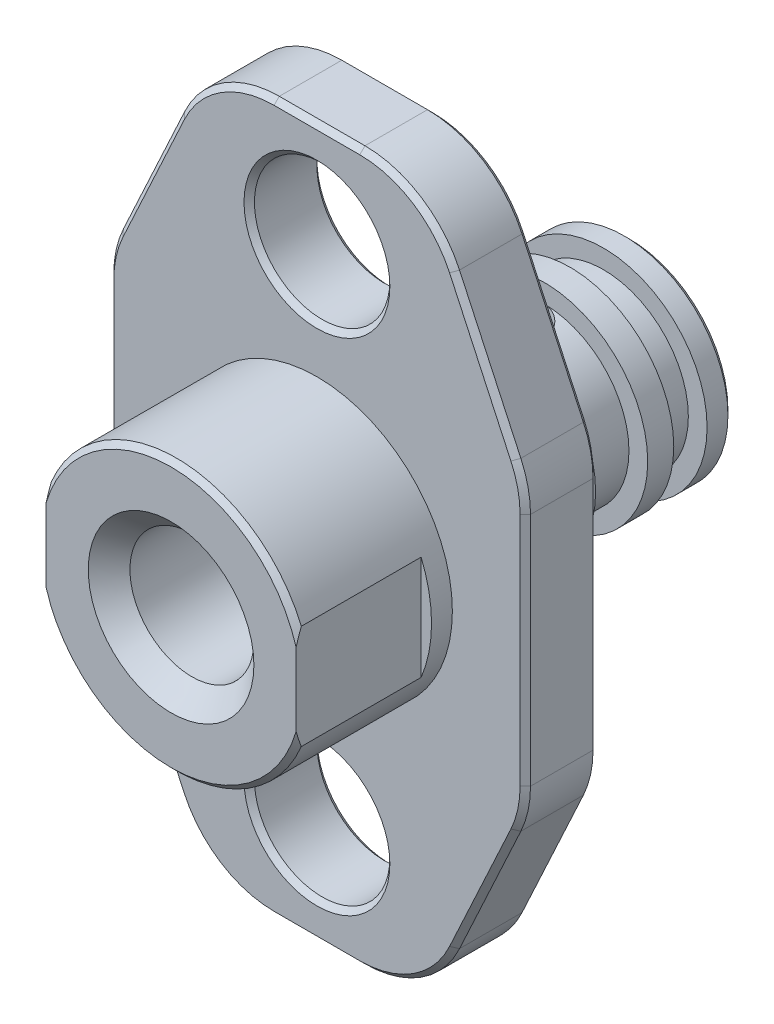
from build123d import *

# Parameters (mm, degrees)
SKETCH3_OUTSIDE_W  = 93.666
SKETCH3_OUTSIDE_H  = 93.666
SKETCH3_OUTSIDE_R  = 6.5
CUT_EXTRUDE1_DEPTH = 21
SKETCH4_W          = 2.5
SKETCH4_H          = 24.819260196
SKETCH7_W          = 2.358889098
SKETCH7_H          = 15
CUT_EXTRUDE2_DEPTH = 12
CIRPATTERN1_COUNT  = 2
CIRPATTERN1_ANGLE  = 180
CHAMFER1_SIZE      = 0.5


with BuildPart() as part:
    # Sketch1 → Revolve1 (revolve)
    with BuildSketch(Plane(origin=(0, 0, 0), x_dir=(0, 0, -1), z_dir=(1, 0, 0))):
        Polygon((14, 13), (0.5, 13), (0, 12.5), (0, 7.95), (2, 5.95), (19, 5.95), (20.171678207, 4), (38, 4), (40.403442476, 0), (44, 0), (44, 9.45), (43.5, 9.95), (41.5, 9.95), (41.5, 8.15), (38.3, 8.15), (38.3, 9.95), (35.8, 9.95), (35.8, 8.15), (30.8, 8.15), (30.8, 9.95), (28.3, 9.95), (28.3, 8.15), (25.1, 8.15), (25.1, 9.95), (21, 9.95), (21, 35), (14, 35), align=None)
    revolve(axis=Axis((0, 0, 0), (0, 0, -1)))

    # Sketch3 outside → Cut-Extrude1 (cut)
    # profile 1 of 3: a face of its own
    with BuildSketch(Plane.XY):
        Rectangle(SKETCH3_OUTSIDE_W, SKETCH3_OUTSIDE_H)
        with BuildLine():
            Line((-20, 11.295529415), (-20, -11.295529415))
            ThreePointArc((-20, -11.295529415), (-19.765527652, -13.448311261), (-19.073106065, -15.500139543))
            Line((-19.073106065, -15.500139543), (-13.185668477, -28.204610128))
            ThreePointArc((-13.185668477, -28.204610128), (-9.495586596, -32.427517466), (-4.112562412, -34))
            Line((-4.112562412, -34), (4.112562412, -34))
            ThreePointArc((4.112562412, -34), (9.495586596, -32.427517466), (13.185668477, -28.204610128))
            Line((13.185668477, -28.204610128), (19.073106065, -15.500139543))
            ThreePointArc((19.073106065, -15.500139543), (19.765527652, -13.448311261), (20, -11.295529415))
            Line((20, -11.295529415), (20, 11.295529415))
            ThreePointArc((20, 11.295529415), (19.765527652, 13.448311261), (19.073106065, 15.500139543))
            Line((19.073106065, 15.500139543), (13.185668477, 28.204610128))
            ThreePointArc((13.185668477, 28.204610128), (9.495586596, 32.427517466), (4.112562412, 34))
            Line((4.112562412, 34), (-4.112562412, 34))
            ThreePointArc((-4.112562412, 34), (-9.495586596, 32.427517466), (-13.185668477, 28.204610128))
            Line((-13.185668477, 28.204610128), (-19.073106065, 15.500139543))
            ThreePointArc((-19.073106065, 15.500139543), (-19.765527652, 13.448311261), (-20, 11.295529415))
        make_face(mode=Mode.SUBTRACT)
    # profile 2 of 3: a face of its own
    with BuildSketch(Plane.XY):
        with Locations((0, 24)):
            Circle(SKETCH3_OUTSIDE_R)
    # profile 3 of 3: a face of its own
    with BuildSketch(Plane.XY):
        with Locations((0, -24)):
            Circle(SKETCH3_OUTSIDE_R)
    extrude(amount=-CUT_EXTRUDE1_DEPTH, mode=Mode.SUBTRACT)

    # Sketch4 → Cut-Revolve1 (revolve, cut)
    with BuildSketch(Plane(origin=(0, 0, 0), x_dir=(0, 0, -1), z_dir=(1, 0, 0))):
        with Locations((34.55, 0)):
            Rectangle(SKETCH4_W, SKETCH4_H)
    revolve(axis=Axis((0, 12.409630098, -33.3), (0, -1, 0)), mode=Mode.SUBTRACT)

    # Sketch7 → Cut-Extrude2 (cut)
    with BuildSketch(Plane.XY):
        with Locations((-13.179444549, -0.815585695)):
            Rectangle(SKETCH7_W, SKETCH7_H)
    cut_extrude2 = extrude(amount=-CUT_EXTRUDE2_DEPTH, mode=Mode.SUBTRACT)

    # CirPattern1: Cut-Extrude2 ×2 about axis
    cirpattern1_axis = Axis((0, 0, 0), (0, 0, -1))
    for i in range(1, CIRPATTERN1_COUNT):
        add(cut_extrude2.rotate(cirpattern1_axis, i * CIRPATTERN1_ANGLE / (CIRPATTERN1_COUNT - 1)), mode=Mode.SUBTRACT)

    # Chamfer1
    chamfer1_edges = [part.edges().sort_by_distance(p)[0] for p in [
        (-6.5, 24, -14),
        (-6.5, 24, -21),
        (-6.5, -24, -14),
        (-6.5, -24, -21),
        (-9.495586596, 32.427517466, -14),
        (0, 34, -14),
        (-16.129387271, 21.852374836, -14),
        (9.495586596, 32.427517466, -14),
        (-19.765527652, 13.448311261, -14),
        (16.129387271, 21.852374836, -14),
        (-20, 0, -14),
        (19.765527652, 13.448311261, -14),
        (-19.765527652, -13.448311261, -14),
        (20, 0, -14),
        (-16.129387271, -21.852374836, -14),
        (19.765527652, -13.448311261, -14),
        (-9.495586596, -32.427517466, -14),
        (16.129387271, -21.852374836, -14),
        (0, -34, -14),
        (9.495586596, -32.427517466, -14),
        (-16.129387271, 21.852374836, -21),
        (-19.765527652, 13.448311261, -21),
        (-9.495586596, 32.427517466, -21),
        (-20, 0, -21),
        (0, 34, -21),
        (-19.765527652, -13.448311261, -21),
        (9.495586596, 32.427517466, -21),
        (-16.129387271, -21.852374836, -21),
        (16.129387271, 21.852374836, -21),
        (-9.495586596, -32.427517466, -21),
        (19.765527652, 13.448311261, -21),
        (0, -34, -21),
        (20, 0, -21),
        (9.495586596, -32.427517466, -21),
        (19.765527652, -13.448311261, -21),
        (16.129387271, -21.852374836, -21),
    ]]
    chamfer(chamfer1_edges, length=CHAMFER1_SIZE)


solid = part.part
